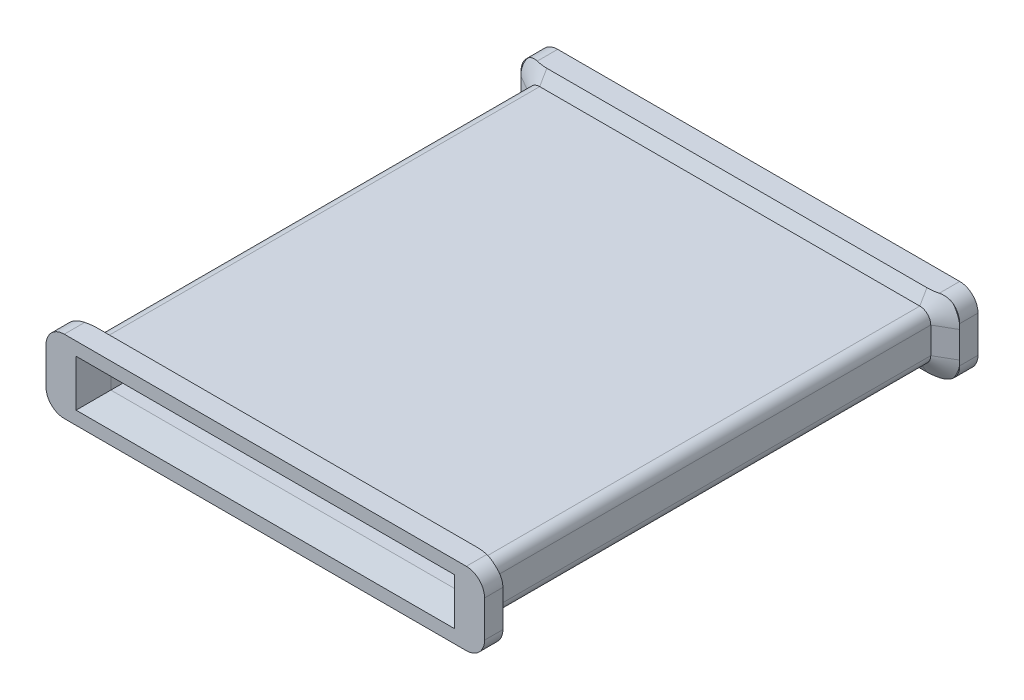
from build123d import *
from OCP.BRepFilletAPI import BRepFilletAPI_MakeChamfer

# Parameters (mm, degrees)
SKETCH1_W           = 48
SKETCH1_H           = 8
SKETCH1_W_2         = 40.8
SKETCH1_H_2         = 4.5
BOSS_EXTRUDE1_DEPTH = 54
CUT_EXTRUDE1_START  = -2
SKETCH2_OUTSIDE_W   = 64.538
SKETCH2_OUTSIDE_H   = 24.538
CUT_EXTRUDE1_DEPTH  = 50
FILLET1_R           = 2
CHAMFER4_SIZE       = 1.17
CHAMFER4_SIZE_2     = 2.026499445
CHAMFER5_SIZE       = 3.5
CHAMFER5_SIZE2      = 0.306210322


with BuildPart() as part:
    # Sketch1 → Boss-Extrude1 (new body)
    with BuildSketch(Plane.XY):
        with Locations((24, 4)):
            Rectangle(SKETCH1_W, SKETCH1_H)
        with Locations((24, 4)):
            Rectangle(SKETCH1_W_2, SKETCH1_H_2, mode=Mode.SUBTRACT)
    extrude(amount=BOSS_EXTRUDE1_DEPTH)

    # Sketch2 outside → Cut-Extrude1 (cut)
    with BuildSketch(Plane.XY.offset(54).offset(CUT_EXTRUDE1_START)):
        with Locations((24, 4)):
            Rectangle(SKETCH2_OUTSIDE_W, SKETCH2_OUTSIDE_H)
        with BuildLine():
            Line((3.2, 6.65), (44.8, 6.65))
            ThreePointArc((44.8, 6.65), (45.648528137, 6.298528137), (46, 5.45))
            Line((46, 5.45), (46, 2.55))
            ThreePointArc((46, 2.55), (45.648528137, 1.701471863), (44.8, 1.35))
            Line((44.8, 1.35), (3.2, 1.35))
            ThreePointArc((3.2, 1.35), (2.351471863, 1.701471863), (2, 2.55))
            Line((2, 2.55), (2, 5.45))
            ThreePointArc((2, 5.45), (2.351471863, 6.298528137), (3.2, 6.65))
        make_face(mode=Mode.SUBTRACT)
    extrude(amount=-CUT_EXTRUDE1_DEPTH, mode=Mode.SUBTRACT)

    # Fillet1
    fillet1_edges = [part.edges().sort_by_distance(p)[0] for p in [
        (48, 0, 1),
        (0, 0, 1),
        (0, 8, 1),
        (48, 8, 1),
        (48, 0, 53),
        (0, 0, 53),
        (0, 8, 53),
        (48, 8, 53),
    ]]
    fillet(fillet1_edges, radius=FILLET1_R)

    # Chamfer4
    # the kernel refuses this chamfer: 2.026499445, 1.17 mm, written as the material it adds along each edge
    with BuildSketch(Plane(origin=(2, 2.55, 52), x_dir=(0.05789386240267108, 0, -0.9983227437537927), z_dir=(0, 1, 0))) as chamfer4_piece_1_section:
        Polygon((CHAMFER4_SIZE * 0.998322743754, CHAMFER4_SIZE * 0.0578938624027), (-CHAMFER4_SIZE_2 * 0.0578938623985, CHAMFER4_SIZE_2 * 0.998322743683), (0, 0), align=None)
    chamfer4_piece_1 = extrude(amount=2.9, mode=Mode.PRIVATE)
    chamfer4_piece_1 = split(chamfer4_piece_1, bisect_by=Plane(origin=(0, 4, 51.609934173), z_dir=(1, 0, 0)), keep=Keep.TOP, mode=Mode.PRIVATE)
    add(chamfer4_piece_1)
    with BuildSketch(Plane(origin=(2, 2.55, 2), x_dir=(-0.999813220622208, 0, -0.019326765612700622), z_dir=(0, 1, 0))) as chamfer4_piece_2_section:
        Polygon((CHAMFER4_SIZE_2 * 0.999813220551, CHAMFER4_SIZE_2 * 0.0193267656113), (-CHAMFER4_SIZE * 0.0193267656127, CHAMFER4_SIZE * 0.999813220622), (0, 0), align=None)
    chamfer4_piece_2 = extrude(amount=2.9, mode=Mode.PRIVATE)
    chamfer4_piece_2 = split(chamfer4_piece_2, bisect_by=Plane(origin=(0, 4, 2.390065827), z_dir=(1, 0, 0)), keep=Keep.TOP, mode=Mode.PRIVATE)
    add(chamfer4_piece_2)
    with BuildSketch(Plane(origin=(3.2, 2.55, 52), x_dir=(0, -1, 0), z_dir=(1, 0, 0))) as chamfer4_piece_3_section:
        Polygon((1.2, CHAMFER4_SIZE), (1.2 + CHAMFER4_SIZE_2, 0), (1.2, 0), align=None)
    chamfer4_piece_3 = revolve(axis=Axis((3.2, 2.55, 52), (0, 0, -1)), revolution_arc=90, mode=Mode.PRIVATE)
    chamfer4_piece_3 = chamfer4_piece_3 & Plane(origin=(2, 2, 51.456530792), x_dir=(0, -1, 0), z_dir=(0, 0, 1)) * Cylinder(2, 13, mode=Mode.PRIVATE)
    add(chamfer4_piece_3)
    with BuildSketch(Plane(origin=(3.2, 2.55, 52), x_dir=(0, -1, 0), z_dir=(1, 0, 0))) as chamfer4_piece_4_section:
        Polygon((1.2, CHAMFER4_SIZE), (1.2 + CHAMFER4_SIZE_2, 0), (1.2, 0), align=None)
    chamfer4_piece_4 = revolve(axis=Axis((3.2, 2.55, 52), (0, 0, -1)), revolution_arc=90, mode=Mode.PRIVATE)
    chamfer4_piece_4 = split(chamfer4_piece_4, bisect_by=Plane(origin=(2, 0.130683468, 51.773765117), z_dir=(1, 0, 0)), keep=Keep.TOP, mode=Mode.PRIVATE)
    chamfer4_piece_4 = split(chamfer4_piece_4, bisect_by=Plane(origin=(2.932508476, 0, 51.773765117), z_dir=(0, 1, 0)), keep=Keep.TOP, mode=Mode.PRIVATE)
    add(chamfer4_piece_4)
    with BuildSketch(Plane(origin=(3.2, 2.55, 52), x_dir=(0, -1, 0), z_dir=(1, 0, 0))) as chamfer4_piece_5_section:
        Polygon((1.2, CHAMFER4_SIZE), (1.2 + CHAMFER4_SIZE_2, 0), (1.2, 0), align=None)
    chamfer4_piece_5 = revolve(axis=Axis((3.2, 2.55, 52), (0, 0, -1)), revolution_arc=90, mode=Mode.PRIVATE)
    chamfer4_piece_5 = split(chamfer4_piece_5, bisect_by=Plane(origin=(0.031272967, 1.35, 51.984062188), z_dir=(0, 1, 0)), keep=Keep.TOP, mode=Mode.PRIVATE)
    chamfer4_piece_5 = split(chamfer4_piece_5, bisect_by=Plane(origin=(0, 2.450571478, 51.984062188), z_dir=(1, 0, 0)), keep=Keep.TOP, mode=Mode.PRIVATE)
    add(chamfer4_piece_5)
    with BuildSketch(Plane(origin=(3.2, 2.55, 2), x_dir=(0, -1, 0), z_dir=(1, 0, 0))) as chamfer4_piece_6_section:
        Polygon((1.2 + CHAMFER4_SIZE_2, 0), (1.2, -CHAMFER4_SIZE), (1.2, 0), align=None)
    chamfer4_piece_6 = revolve(axis=Axis((3.2, 2.55, 2), (0, 0, -1)), revolution_arc=90, mode=Mode.PRIVATE)
    chamfer4_piece_6 = split(chamfer4_piece_6, bisect_by=Plane(origin=(2.932508484, 0, 2.226234886), z_dir=(0, 1, 0)), keep=Keep.TOP, mode=Mode.PRIVATE)
    chamfer4_piece_6 = split(chamfer4_piece_6, bisect_by=Plane(origin=(2, 0.130683471, 2.226234886), z_dir=(1, 0, 0)), keep=Keep.TOP, mode=Mode.PRIVATE)
    add(chamfer4_piece_6)
    with BuildSketch(Plane(origin=(3.2, 2.55, 2), x_dir=(0, -1, 0), z_dir=(1, 0, 0))) as chamfer4_piece_7_section:
        Polygon((1.2 + CHAMFER4_SIZE_2, 0), (1.2, -CHAMFER4_SIZE), (1.2, 0), align=None)
    chamfer4_piece_7 = revolve(axis=Axis((3.2, 2.55, 2), (0, 0, -1)), revolution_arc=90, mode=Mode.PRIVATE)
    chamfer4_piece_7 = chamfer4_piece_7 & Plane(origin=(2, 2, 2.22929574), x_dir=(-1, 0, 0), z_dir=(0, 0, 1)) * Cylinder(2, 13, mode=Mode.PRIVATE)
    add(chamfer4_piece_7)
    with BuildSketch(Plane(origin=(3.2, 2.55, 2), x_dir=(0, -1, 0), z_dir=(1, 0, 0))) as chamfer4_piece_8_section:
        Polygon((1.2 + CHAMFER4_SIZE_2, 0), (1.2, -CHAMFER4_SIZE), (1.2, 0), align=None)
    chamfer4_piece_8 = revolve(axis=Axis((3.2, 2.55, 2), (0, 0, -1)), revolution_arc=90, mode=Mode.PRIVATE)
    chamfer4_piece_8 = split(chamfer4_piece_8, bisect_by=Plane(origin=(0, 2.450571478, 2.015937812), z_dir=(1, 0, 0)), keep=Keep.TOP, mode=Mode.PRIVATE)
    chamfer4_piece_8 = split(chamfer4_piece_8, bisect_by=Plane(origin=(0.031272967, 1.35, 2.015937812), z_dir=(0, 1, 0)), keep=Keep.TOP, mode=Mode.PRIVATE)
    add(chamfer4_piece_8)
    with BuildSketch(Plane(origin=(3.2, 5.45, 52), x_dir=(-1, 0, 0), z_dir=(0, -1, 0))) as chamfer4_piece_9_section:
        Polygon((1.2, CHAMFER4_SIZE), (1.2 + CHAMFER4_SIZE_2, 0), (1.2, 0), align=None)
    chamfer4_piece_9 = revolve(axis=Axis((3.2, 5.45, 52), (0, 0, -1)), revolution_arc=90, mode=Mode.PRIVATE)
    chamfer4_piece_9 = chamfer4_piece_9 & Plane(origin=(2, 6, 51.456530792), x_dir=(0, 1, 0), z_dir=(0, 0, 1)) * Cylinder(2, 13, mode=Mode.PRIVATE)
    add(chamfer4_piece_9)
    with BuildSketch(Plane(origin=(3.2, 5.45, 52), x_dir=(-1, 0, 0), z_dir=(0, -1, 0))) as chamfer4_piece_10_section:
        Polygon((1.2, CHAMFER4_SIZE), (1.2 + CHAMFER4_SIZE_2, 0), (1.2, 0), align=None)
    chamfer4_piece_10 = revolve(axis=Axis((3.2, 5.45, 52), (0, 0, -1)), revolution_arc=90, mode=Mode.PRIVATE)
    chamfer4_piece_10 = split(chamfer4_piece_10, bisect_by=Plane(origin=(0.031272967, 6.65, 51.984062188), z_dir=(0, -1, 0)), keep=Keep.TOP, mode=Mode.PRIVATE)
    chamfer4_piece_10 = split(chamfer4_piece_10, bisect_by=Plane(origin=(0, 5.549428522, 51.984062188), z_dir=(1, 0, 0)), keep=Keep.TOP, mode=Mode.PRIVATE)
    add(chamfer4_piece_10)
    with BuildSketch(Plane(origin=(3.2, 5.45, 52), x_dir=(-1, 0, 0), z_dir=(0, -1, 0))) as chamfer4_piece_11_section:
        Polygon((1.2, CHAMFER4_SIZE), (1.2 + CHAMFER4_SIZE_2, 0), (1.2, 0), align=None)
    chamfer4_piece_11 = revolve(axis=Axis((3.2, 5.45, 52), (0, 0, -1)), revolution_arc=90, mode=Mode.PRIVATE)
    chamfer4_piece_11 = split(chamfer4_piece_11, bisect_by=Plane(origin=(2, 7.869316535, 51.773765118), z_dir=(1, 0, 0)), keep=Keep.TOP, mode=Mode.PRIVATE)
    chamfer4_piece_11 = split(chamfer4_piece_11, bisect_by=Plane(origin=(2.932508473, 8, 51.773765118), z_dir=(0, -1, 0)), keep=Keep.TOP, mode=Mode.PRIVATE)
    add(chamfer4_piece_11)
    with BuildSketch(Plane(origin=(3.2, 5.45, 2), x_dir=(-1, 0, 0), z_dir=(0, -1, 0))) as chamfer4_piece_12_section:
        Polygon((1.2 + CHAMFER4_SIZE_2, 0), (1.2, -CHAMFER4_SIZE), (1.2, 0), align=None)
    chamfer4_piece_12 = revolve(axis=Axis((3.2, 5.45, 2), (0, 0, -1)), revolution_arc=90, mode=Mode.PRIVATE)
    chamfer4_piece_12 = split(chamfer4_piece_12, bisect_by=Plane(origin=(0, 5.549428522, 2.015937812), z_dir=(1, 0, 0)), keep=Keep.TOP, mode=Mode.PRIVATE)
    chamfer4_piece_12 = split(chamfer4_piece_12, bisect_by=Plane(origin=(0.031272967, 6.65, 2.015937812), z_dir=(0, -1, 0)), keep=Keep.TOP, mode=Mode.PRIVATE)
    add(chamfer4_piece_12)
    with BuildSketch(Plane(origin=(3.2, 5.45, 2), x_dir=(-1, 0, 0), z_dir=(0, -1, 0))) as chamfer4_piece_13_section:
        Polygon((1.2 + CHAMFER4_SIZE_2, 0), (1.2, -CHAMFER4_SIZE), (1.2, 0), align=None)
    chamfer4_piece_13 = revolve(axis=Axis((3.2, 5.45, 2), (0, 0, -1)), revolution_arc=90, mode=Mode.PRIVATE)
    chamfer4_piece_13 = chamfer4_piece_13 & Plane(origin=(2, 6, 2.22929574), x_dir=(0, 1, 0), z_dir=(0, 0, 1)) * Cylinder(2, 13, mode=Mode.PRIVATE)
    add(chamfer4_piece_13)
    with BuildSketch(Plane(origin=(3.2, 5.45, 2), x_dir=(-1, 0, 0), z_dir=(0, -1, 0))) as chamfer4_piece_14_section:
        Polygon((1.2 + CHAMFER4_SIZE_2, 0), (1.2, -CHAMFER4_SIZE), (1.2, 0), align=None)
    chamfer4_piece_14 = revolve(axis=Axis((3.2, 5.45, 2), (0, 0, -1)), revolution_arc=90, mode=Mode.PRIVATE)
    chamfer4_piece_14 = split(chamfer4_piece_14, bisect_by=Plane(origin=(2.932508473, 8, 2.226234882), z_dir=(0, -1, 0)), keep=Keep.TOP, mode=Mode.PRIVATE)
    chamfer4_piece_14 = split(chamfer4_piece_14, bisect_by=Plane(origin=(2, 7.869316535, 2.226234882), z_dir=(1, 0, 0)), keep=Keep.TOP, mode=Mode.PRIVATE)
    add(chamfer4_piece_14)
    with BuildSketch(Plane(origin=(44.8, 1.35, 52), x_dir=(0, 0.05789386240267127, -0.9983227437537927), z_dir=(-1, 0, 0))) as chamfer4_piece_15_section:
        Polygon((CHAMFER4_SIZE * 0.998322743754, CHAMFER4_SIZE * 0.0578938624027), (-CHAMFER4_SIZE_2 * 0.0578938623985, CHAMFER4_SIZE_2 * 0.998322743683), (0, 0), align=None)
    chamfer4_piece_15 = extrude(amount=41.6, mode=Mode.PRIVATE)
    chamfer4_piece_15 = split(chamfer4_piece_15, bisect_by=Plane(origin=(24, 0, 51.577415794), z_dir=(0, 1, 0)), keep=Keep.TOP, mode=Mode.PRIVATE)
    add(chamfer4_piece_15)
    with BuildSketch(Plane(origin=(44.8, 1.35, 2), x_dir=(0, -0.999813220622208, -0.019326765612700633), z_dir=(-1, 0, 0))) as chamfer4_piece_16_section:
        Polygon((CHAMFER4_SIZE_2 * 0.999813220551, CHAMFER4_SIZE_2 * 0.0193267656113), (-CHAMFER4_SIZE * 0.0193267656127, CHAMFER4_SIZE * 0.999813220622), (0, 0), align=None)
    chamfer4_piece_16 = extrude(amount=41.6, mode=Mode.PRIVATE)
    chamfer4_piece_16 = split(chamfer4_piece_16, bisect_by=Plane(origin=(24, 0, 2.422584206), z_dir=(0, 1, 0)), keep=Keep.TOP, mode=Mode.PRIVATE)
    add(chamfer4_piece_16)
    with BuildSketch(Plane(origin=(3.2, 6.65, 52), x_dir=(0, -0.05789386240267145, -0.9983227437537927), z_dir=(1, 0, 0))) as chamfer4_piece_17_section:
        Polygon((CHAMFER4_SIZE * 0.998322743754, CHAMFER4_SIZE * 0.0578938624027), (-CHAMFER4_SIZE_2 * 0.0578938623985, CHAMFER4_SIZE_2 * 0.998322743683), (0, 0), align=None)
    chamfer4_piece_17 = extrude(amount=41.6, mode=Mode.PRIVATE)
    chamfer4_piece_17 = split(chamfer4_piece_17, bisect_by=Plane(origin=(24, 8, 51.577415794), z_dir=(0, -1, 0)), keep=Keep.TOP, mode=Mode.PRIVATE)
    add(chamfer4_piece_17)
    with BuildSketch(Plane(origin=(3.2, 6.65, 2), x_dir=(0, 0.999813220622208, -0.019326765612700633), z_dir=(1, 0, 0))) as chamfer4_piece_18_section:
        Polygon((CHAMFER4_SIZE_2 * 0.999813220551, CHAMFER4_SIZE_2 * 0.0193267656113), (-CHAMFER4_SIZE * 0.0193267656127, CHAMFER4_SIZE * 0.999813220622), (0, 0), align=None)
    chamfer4_piece_18 = extrude(amount=41.6, mode=Mode.PRIVATE)
    chamfer4_piece_18 = split(chamfer4_piece_18, bisect_by=Plane(origin=(24, 8, 2.422584206), z_dir=(0, -1, 0)), keep=Keep.TOP, mode=Mode.PRIVATE)
    add(chamfer4_piece_18)
    with BuildSketch(Plane(origin=(44.8, 2.55, 52), x_dir=(1, 0, 0), z_dir=(0, 1, 0))) as chamfer4_piece_19_section:
        Polygon((1.2, CHAMFER4_SIZE), (1.2 + CHAMFER4_SIZE_2, 0), (1.2, 0), align=None)
    chamfer4_piece_19 = revolve(axis=Axis((44.8, 2.55, 52), (0, 0, -1)), revolution_arc=90, mode=Mode.PRIVATE)
    chamfer4_piece_19 = chamfer4_piece_19 & Plane(origin=(46, 2, 51.456530792), x_dir=(1, 0, 0), z_dir=(0, 0, 1)) * Cylinder(2, 13, mode=Mode.PRIVATE)
    add(chamfer4_piece_19)
    with BuildSketch(Plane(origin=(44.8, 2.55, 52), x_dir=(1, 0, 0), z_dir=(0, 1, 0))) as chamfer4_piece_20_section:
        Polygon((1.2, CHAMFER4_SIZE), (1.2 + CHAMFER4_SIZE_2, 0), (1.2, 0), align=None)
    chamfer4_piece_20 = revolve(axis=Axis((44.8, 2.55, 52), (0, 0, -1)), revolution_arc=90, mode=Mode.PRIVATE)
    chamfer4_piece_20 = split(chamfer4_piece_20, bisect_by=Plane(origin=(47.968727033, 1.35, 51.984062188), z_dir=(0, 1, 0)), keep=Keep.TOP, mode=Mode.PRIVATE)
    chamfer4_piece_20 = split(chamfer4_piece_20, bisect_by=Plane(origin=(48, 2.450571478, 51.984062188), z_dir=(-1, 0, 0)), keep=Keep.TOP, mode=Mode.PRIVATE)
    add(chamfer4_piece_20)
    with BuildSketch(Plane(origin=(44.8, 2.55, 52), x_dir=(1, 0, 0), z_dir=(0, 1, 0))) as chamfer4_piece_21_section:
        Polygon((1.2, CHAMFER4_SIZE), (1.2 + CHAMFER4_SIZE_2, 0), (1.2, 0), align=None)
    chamfer4_piece_21 = revolve(axis=Axis((44.8, 2.55, 52), (0, 0, -1)), revolution_arc=90, mode=Mode.PRIVATE)
    chamfer4_piece_21 = split(chamfer4_piece_21, bisect_by=Plane(origin=(46, 0.130683468, 51.773765114), z_dir=(-1, 0, 0)), keep=Keep.TOP, mode=Mode.PRIVATE)
    chamfer4_piece_21 = split(chamfer4_piece_21, bisect_by=Plane(origin=(45.067491519, 0, 51.773765114), z_dir=(0, 1, 0)), keep=Keep.TOP, mode=Mode.PRIVATE)
    add(chamfer4_piece_21)
    with BuildSketch(Plane(origin=(44.8, 2.55, 2), x_dir=(1, 0, 0), z_dir=(0, 1, 0))) as chamfer4_piece_22_section:
        Polygon((1.2 + CHAMFER4_SIZE_2, 0), (1.2, -CHAMFER4_SIZE), (1.2, 0), align=None)
    chamfer4_piece_22 = revolve(axis=Axis((44.8, 2.55, 2), (0, 0, -1)), revolution_arc=90, mode=Mode.PRIVATE)
    chamfer4_piece_22 = split(chamfer4_piece_22, bisect_by=Plane(origin=(48, 2.450571478, 2.015937812), z_dir=(-1, 0, 0)), keep=Keep.TOP, mode=Mode.PRIVATE)
    chamfer4_piece_22 = split(chamfer4_piece_22, bisect_by=Plane(origin=(47.968727033, 1.35, 2.015937812), z_dir=(0, 1, 0)), keep=Keep.TOP, mode=Mode.PRIVATE)
    add(chamfer4_piece_22)
    with BuildSketch(Plane(origin=(44.8, 2.55, 2), x_dir=(1, 0, 0), z_dir=(0, 1, 0))) as chamfer4_piece_23_section:
        Polygon((1.2 + CHAMFER4_SIZE_2, 0), (1.2, -CHAMFER4_SIZE), (1.2, 0), align=None)
    chamfer4_piece_23 = revolve(axis=Axis((44.8, 2.55, 2), (0, 0, -1)), revolution_arc=90, mode=Mode.PRIVATE)
    chamfer4_piece_23 = chamfer4_piece_23 & Plane(origin=(46, 2, 2.22929574), x_dir=(1, 0, 0), z_dir=(0, 0, 1)) * Cylinder(2, 13, mode=Mode.PRIVATE)
    add(chamfer4_piece_23)
    with BuildSketch(Plane(origin=(44.8, 2.55, 2), x_dir=(1, 0, 0), z_dir=(0, 1, 0))) as chamfer4_piece_24_section:
        Polygon((1.2 + CHAMFER4_SIZE_2, 0), (1.2, -CHAMFER4_SIZE), (1.2, 0), align=None)
    chamfer4_piece_24 = revolve(axis=Axis((44.8, 2.55, 2), (0, 0, -1)), revolution_arc=90, mode=Mode.PRIVATE)
    chamfer4_piece_24 = split(chamfer4_piece_24, bisect_by=Plane(origin=(45.067491519, 0, 2.226234886), z_dir=(0, 1, 0)), keep=Keep.TOP, mode=Mode.PRIVATE)
    chamfer4_piece_24 = split(chamfer4_piece_24, bisect_by=Plane(origin=(46, 0.130683468, 2.226234886), z_dir=(-1, 0, 0)), keep=Keep.TOP, mode=Mode.PRIVATE)
    add(chamfer4_piece_24)
    with BuildSketch(Plane(origin=(44.8, 5.45, 52), x_dir=(0, 1, 0), z_dir=(-1, 0, 0))) as chamfer4_piece_25_section:
        Polygon((1.2, CHAMFER4_SIZE), (1.2 + CHAMFER4_SIZE_2, 0), (1.2, 0), align=None)
    chamfer4_piece_25 = revolve(axis=Axis((44.8, 5.45, 52), (0, 0, -1)), revolution_arc=90, mode=Mode.PRIVATE)
    chamfer4_piece_25 = chamfer4_piece_25 & Plane(origin=(46, 6, 51.456530792), x_dir=(0, 1, 0), z_dir=(0, 0, 1)) * Cylinder(2, 13, mode=Mode.PRIVATE)
    add(chamfer4_piece_25)
    with BuildSketch(Plane(origin=(44.8, 5.45, 52), x_dir=(0, 1, 0), z_dir=(-1, 0, 0))) as chamfer4_piece_26_section:
        Polygon((1.2, CHAMFER4_SIZE), (1.2 + CHAMFER4_SIZE_2, 0), (1.2, 0), align=None)
    chamfer4_piece_26 = revolve(axis=Axis((44.8, 5.45, 52), (0, 0, -1)), revolution_arc=90, mode=Mode.PRIVATE)
    chamfer4_piece_26 = split(chamfer4_piece_26, bisect_by=Plane(origin=(46, 7.869316532, 51.773765117), z_dir=(-1, 0, 0)), keep=Keep.TOP, mode=Mode.PRIVATE)
    chamfer4_piece_26 = split(chamfer4_piece_26, bisect_by=Plane(origin=(45.067491524, 8, 51.773765117), z_dir=(0, -1, 0)), keep=Keep.TOP, mode=Mode.PRIVATE)
    add(chamfer4_piece_26)
    with BuildSketch(Plane(origin=(44.8, 5.45, 52), x_dir=(0, 1, 0), z_dir=(-1, 0, 0))) as chamfer4_piece_27_section:
        Polygon((1.2, CHAMFER4_SIZE), (1.2 + CHAMFER4_SIZE_2, 0), (1.2, 0), align=None)
    chamfer4_piece_27 = revolve(axis=Axis((44.8, 5.45, 52), (0, 0, -1)), revolution_arc=90, mode=Mode.PRIVATE)
    chamfer4_piece_27 = split(chamfer4_piece_27, bisect_by=Plane(origin=(47.968727033, 6.65, 51.984062188), z_dir=(0, -1, 0)), keep=Keep.TOP, mode=Mode.PRIVATE)
    chamfer4_piece_27 = split(chamfer4_piece_27, bisect_by=Plane(origin=(48, 5.549428522, 51.984062188), z_dir=(-1, 0, 0)), keep=Keep.TOP, mode=Mode.PRIVATE)
    add(chamfer4_piece_27)
    with BuildSketch(Plane(origin=(44.8, 5.45, 2), x_dir=(0, 1, 0), z_dir=(-1, 0, 0))) as chamfer4_piece_28_section:
        Polygon((1.2 + CHAMFER4_SIZE_2, 0), (1.2, -CHAMFER4_SIZE), (1.2, 0), align=None)
    chamfer4_piece_28 = revolve(axis=Axis((44.8, 5.45, 2), (0, 0, -1)), revolution_arc=90, mode=Mode.PRIVATE)
    chamfer4_piece_28 = split(chamfer4_piece_28, bisect_by=Plane(origin=(45.067491524, 8, 2.226234883), z_dir=(0, -1, 0)), keep=Keep.TOP, mode=Mode.PRIVATE)
    chamfer4_piece_28 = split(chamfer4_piece_28, bisect_by=Plane(origin=(46, 7.869316532, 2.226234883), z_dir=(-1, 0, 0)), keep=Keep.TOP, mode=Mode.PRIVATE)
    add(chamfer4_piece_28)
    with BuildSketch(Plane(origin=(44.8, 5.45, 2), x_dir=(0, 1, 0), z_dir=(-1, 0, 0))) as chamfer4_piece_29_section:
        Polygon((1.2 + CHAMFER4_SIZE_2, 0), (1.2, -CHAMFER4_SIZE), (1.2, 0), align=None)
    chamfer4_piece_29 = revolve(axis=Axis((44.8, 5.45, 2), (0, 0, -1)), revolution_arc=90, mode=Mode.PRIVATE)
    chamfer4_piece_29 = chamfer4_piece_29 & Plane(origin=(46, 6, 2.22929574), x_dir=(0, 1, 0), z_dir=(0, 0, 1)) * Cylinder(2, 13, mode=Mode.PRIVATE)
    add(chamfer4_piece_29)
    with BuildSketch(Plane(origin=(44.8, 5.45, 2), x_dir=(0, 1, 0), z_dir=(-1, 0, 0))) as chamfer4_piece_30_section:
        Polygon((1.2 + CHAMFER4_SIZE_2, 0), (1.2, -CHAMFER4_SIZE), (1.2, 0), align=None)
    chamfer4_piece_30 = revolve(axis=Axis((44.8, 5.45, 2), (0, 0, -1)), revolution_arc=90, mode=Mode.PRIVATE)
    chamfer4_piece_30 = split(chamfer4_piece_30, bisect_by=Plane(origin=(48, 5.549428522, 2.015937812), z_dir=(-1, 0, 0)), keep=Keep.TOP, mode=Mode.PRIVATE)
    chamfer4_piece_30 = split(chamfer4_piece_30, bisect_by=Plane(origin=(47.968727033, 6.65, 2.015937812), z_dir=(0, -1, 0)), keep=Keep.TOP, mode=Mode.PRIVATE)
    add(chamfer4_piece_30)
    with BuildSketch(Plane(origin=(46, 5.45, 52), x_dir=(-0.057893862402670714, 0, -0.9983227437537927), z_dir=(0, -1, 0))) as chamfer4_piece_31_section:
        Polygon((CHAMFER4_SIZE * 0.998322743754, CHAMFER4_SIZE * 0.0578938624027), (-CHAMFER4_SIZE_2 * 0.0578938623985, CHAMFER4_SIZE_2 * 0.998322743683), (0, 0), align=None)
    chamfer4_piece_31 = extrude(amount=2.9, mode=Mode.PRIVATE)
    chamfer4_piece_31 = split(chamfer4_piece_31, bisect_by=Plane(origin=(48, 4, 51.609934173), z_dir=(-1, 0, 0)), keep=Keep.TOP, mode=Mode.PRIVATE)
    add(chamfer4_piece_31)
    with BuildSketch(Plane(origin=(46, 5.45, 2), x_dir=(0.999813220622208, 0, -0.019326765612700657), z_dir=(0, -1, 0))) as chamfer4_piece_32_section:
        Polygon((CHAMFER4_SIZE_2 * 0.999813220551, CHAMFER4_SIZE_2 * 0.0193267656113), (-CHAMFER4_SIZE * 0.0193267656127, CHAMFER4_SIZE * 0.999813220622), (0, 0), align=None)
    chamfer4_piece_32 = extrude(amount=2.9, mode=Mode.PRIVATE)
    chamfer4_piece_32 = split(chamfer4_piece_32, bisect_by=Plane(origin=(48, 4, 2.390065827), z_dir=(-1, 0, 0)), keep=Keep.TOP, mode=Mode.PRIVATE)
    add(chamfer4_piece_32)

    # Chamfer5: one chamfer whose edges measure the first distance from different faces: ONE call of the kernel's chamfer builder (chamfer() names one face for all edges)
    chamfer5_edges_1 = [part.edges().sort_by_distance(p)[0] for p in [
        (3.6, 4, 0),
        (3.6, 4, 54),
    ]]
    chamfer5_side_1 = [part.faces().sort_by_distance(p)[0] for p in [
        (3.6, 4, 27),
    ]]
    chamfer5_edges_2 = [part.edges().sort_by_distance(p)[0] for p in [
        (24, 1.75, 0),
        (24, 1.75, 54),
    ]]
    chamfer5_side_2 = [part.faces().sort_by_distance(p)[0] for p in [
        (24, 1.75, 27),
    ]]
    chamfer5_edges_3 = [part.edges().sort_by_distance(p)[0] for p in [
        (44.4, 4, 0),
        (44.4, 4, 54),
    ]]
    chamfer5_side_3 = [part.faces().sort_by_distance(p)[0] for p in [
        (44.4, 4, 27),
    ]]
    chamfer5_edges_4 = [part.edges().sort_by_distance(p)[0] for p in [
        (24, 6.25, 0),
        (24, 6.25, 54),
    ]]
    chamfer5_side_4 = [part.faces().sort_by_distance(p)[0] for p in [
        (24, 6.25, 27),
    ]]
    chamfer5 = BRepFilletAPI_MakeChamfer(part.part.solid().wrapped)
    for e in chamfer5_edges_1:
        chamfer5.Add(CHAMFER5_SIZE, CHAMFER5_SIZE2, e.wrapped, chamfer5_side_1[0].wrapped)  # the first distance lies on this face
    for e in chamfer5_edges_2:
        chamfer5.Add(CHAMFER5_SIZE, CHAMFER5_SIZE2, e.wrapped, chamfer5_side_2[0].wrapped)  # the first distance lies on this face
    for e in chamfer5_edges_3:
        chamfer5.Add(CHAMFER5_SIZE, CHAMFER5_SIZE2, e.wrapped, chamfer5_side_3[0].wrapped)  # the first distance lies on this face
    for e in chamfer5_edges_4:
        chamfer5.Add(CHAMFER5_SIZE, CHAMFER5_SIZE2, e.wrapped, chamfer5_side_4[0].wrapped)  # the first distance lies on this face
    add(Compound.cast(chamfer5.Shape()), mode=Mode.REPLACE)


solid = part.part
